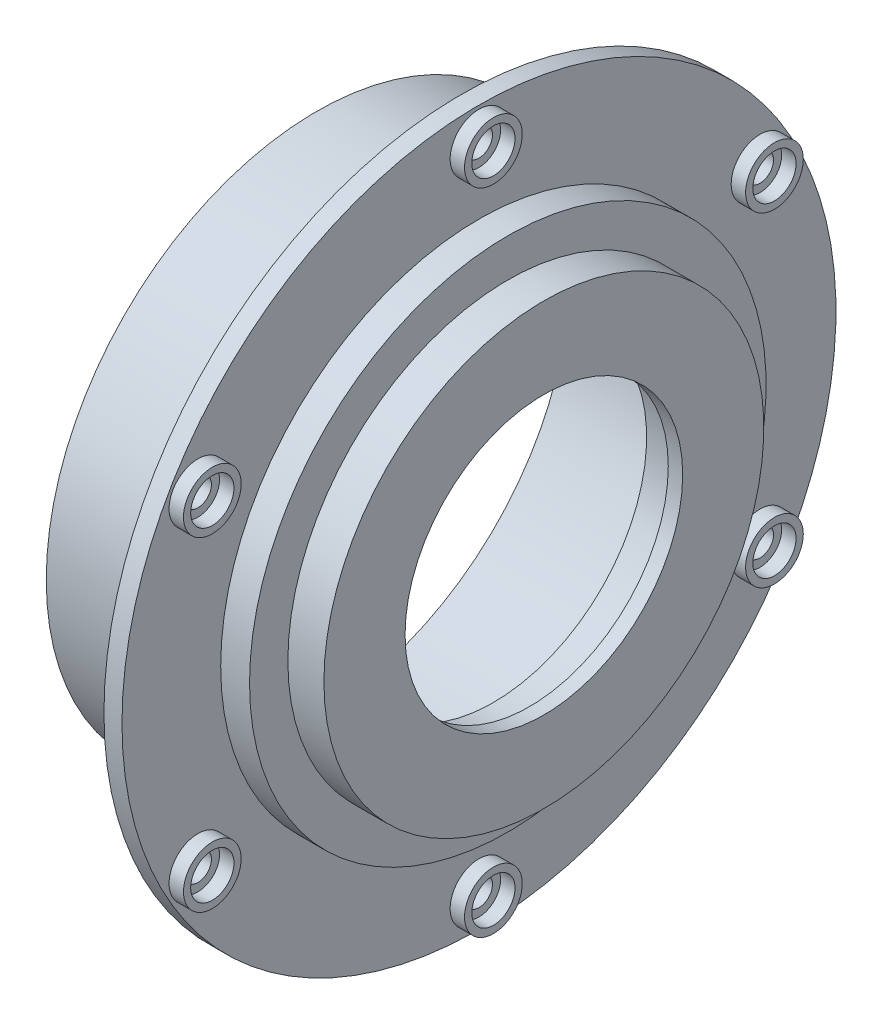
from build123d import *

# Parameters (mm, degrees)
SKETCH3_R           = 3.75
CUT_EXTRUDE1_DEPTH  = 10
SKETCH4_R           = 8
SKETCH4_R_2         = 6
BOSS_EXTRUDE1_DEPTH = 4


with BuildPart() as part:
    # Sketch1 → Revolve1 (revolve)
    with BuildSketch(Plane.XY):
        Polygon((0, 0), (39, 0), (39, -9), (49, -9), (49, -27.5), (59, -27.5), (59, -31.5), (63, -31.5), (63, -9), (53, -9), (53, 1.623676176), (45, 1.623676176), (45, 29), (40, 29), (40, 5), (0, 5), align=None)
    revolve(axis=Axis((0, -70, 0), (1, 0, 0)))

    # Sketch3 → Cut-Extrude1 (cut)
    with BuildSketch(Plane(origin=(45, 0, 0), x_dir=(0, 0, -1), z_dir=(1, 0, 0))):
        with Locations((0, 20)):
            Circle(SKETCH3_R)
        with Locations((77.942286341, -25)):
            Circle(SKETCH3_R)
        with Locations((77.942286341, -115)):
            Circle(SKETCH3_R)
        with Locations((0, -160)):
            Circle(SKETCH3_R)
        with Locations((-77.942286341, -115)):
            Circle(SKETCH3_R)
        with Locations((-77.942286341, -25)):
            Circle(SKETCH3_R)
    extrude(amount=-CUT_EXTRUDE1_DEPTH, mode=Mode.SUBTRACT)

    # Sketch4 → Boss-Extrude1 (add)
    # profile 1 of 6: a face of its own
    with BuildSketch(Plane(origin=(45, 0, 0), x_dir=(0, 0, -1), z_dir=(1, 0, 0))):
        with Locations((0, 20)):
            Circle(SKETCH4_R)
        with Locations((0, 20)):
            Circle(SKETCH4_R_2, mode=Mode.SUBTRACT)
    # profile 2 of 6: a face of its own
    with BuildSketch(Plane(origin=(45, 0, 0), x_dir=(0, 0, -1), z_dir=(1, 0, 0))):
        with Locations((77.942286341, -25)):
            Circle(SKETCH4_R)
        with Locations((77.942286341, -25)):
            Circle(SKETCH4_R_2, mode=Mode.SUBTRACT)
    # profile 3 of 6: a face of its own
    with BuildSketch(Plane(origin=(45, 0, 0), x_dir=(0, 0, -1), z_dir=(1, 0, 0))):
        with Locations((77.942286341, -115)):
            Circle(SKETCH4_R)
        with Locations((77.942286341, -115)):
            Circle(SKETCH4_R_2, mode=Mode.SUBTRACT)
    # profile 4 of 6: a face of its own
    with BuildSketch(Plane(origin=(45, 0, 0), x_dir=(0, 0, -1), z_dir=(1, 0, 0))):
        with Locations((0, -160)):
            Circle(SKETCH4_R)
        with Locations((0, -160)):
            Circle(SKETCH4_R_2, mode=Mode.SUBTRACT)
    # profile 5 of 6: a face of its own
    with BuildSketch(Plane(origin=(45, 0, 0), x_dir=(0, 0, -1), z_dir=(1, 0, 0))):
        with Locations((-77.942286341, -115)):
            Circle(SKETCH4_R)
        with Locations((-77.942286341, -115)):
            Circle(SKETCH4_R_2, mode=Mode.SUBTRACT)
    # profile 6 of 6: a face of its own
    with BuildSketch(Plane(origin=(45, 0, 0), x_dir=(0, 0, -1), z_dir=(1, 0, 0))):
        with Locations((-77.942286341, -25)):
            Circle(SKETCH4_R)
        with Locations((-77.942286341, -25)):
            Circle(SKETCH4_R_2, mode=Mode.SUBTRACT)
    extrude(amount=BOSS_EXTRUDE1_DEPTH)


solid = part.part
